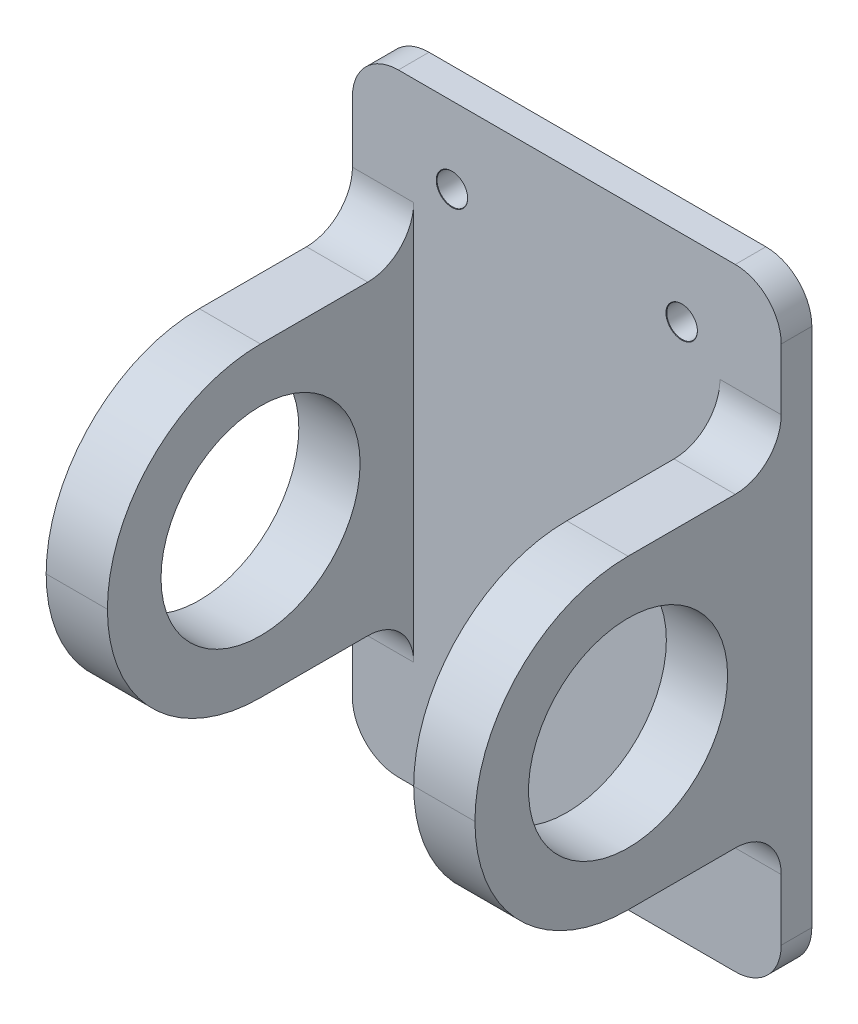
from build123d import *

# Parameters (mm, degrees)
SKETCH1_W                       = 40
SKETCH1_H                       = 28
BOSS_EXTRUDE1_DEPTH             = 2
SKETCH2_W                       = 20
SKETCH2_H                       = 4
BOSS_EXTRUDE2_DEPTH             = 20
FILLET1_R                       = 10
F_10_0MM_DOWEL_HOLE1_D          = 13
F_2_0MM_DOWEL_HOLE1_D           = 2
F_2_0MM_DOWEL_HOLE1_CSINK_D     = 2.05
F_2_0MM_DOWEL_HOLE1_CSINK_ANGLE = 90
FILLET2_R                       = 3


with BuildPart() as part:
    # Sketch1 → Boss-Extrude1 (new body)
    with BuildSketch(Plane(origin=(0, 0, 0), x_dir=(0, 1, 0), z_dir=(0, 0, 1))):
        Rectangle(SKETCH1_W, SKETCH1_H)
    extrude(amount=-BOSS_EXTRUDE1_DEPTH)

    # Sketch2 → Boss-Extrude2 (add)
    with BuildSketch(Plane(origin=(0, 0, 0), x_dir=(0, 1, 0), z_dir=(0, 0, 1))):
        with Locations((0, 12)):
            Rectangle(SKETCH2_W, SKETCH2_H)
        with Locations((0, -12)):
            Rectangle(SKETCH2_W, SKETCH2_H)
    extrude(amount=BOSS_EXTRUDE2_DEPTH)

    # Fillet1
    fillet1_edges = [part.edges().sort_by_distance(p)[0] for p in [
        (12, 10, 20),
        (12, -10, 20),
        (-12, 10, 20),
        (-12, -10, 20),
    ]]
    fillet(fillet1_edges, radius=FILLET1_R - 0.0001)  # a hair under: the kernel refuses the full size

    # Ø10.0mm Dowel Hole1 (through all)
    with Locations(Plane.YZ.offset(14)):
        with Locations((0, 10)):
            Hole(F_10_0MM_DOWEL_HOLE1_D / 2)

    # Ø2.0mm Dowel Hole1 (through all)
    with Locations(Plane(origin=(0, 0, 0), x_dir=(0, 1, 0), z_dir=(0, 0, 1))):
        with Locations((15, -7.5), (-15, 7.5), (-15, -7.5), (15, 7.5)):
            CounterSinkHole(F_2_0MM_DOWEL_HOLE1_D / 2, F_2_0MM_DOWEL_HOLE1_CSINK_D / 2, counter_sink_angle=F_2_0MM_DOWEL_HOLE1_CSINK_ANGLE)

    # Fillet2
    fillet2_edges = [part.edges().sort_by_distance(p)[0] for p in [
        (-12, -10, 0),
        (-12, 10, 0),
        (12, -10, 0),
        (12, 10, 0),
        (-14, -20, -1),
        (-14, 20, -1),
        (14, 20, -1),
        (14, -20, -1),
    ]]
    fillet(fillet2_edges, radius=FILLET2_R)


solid = part.part
